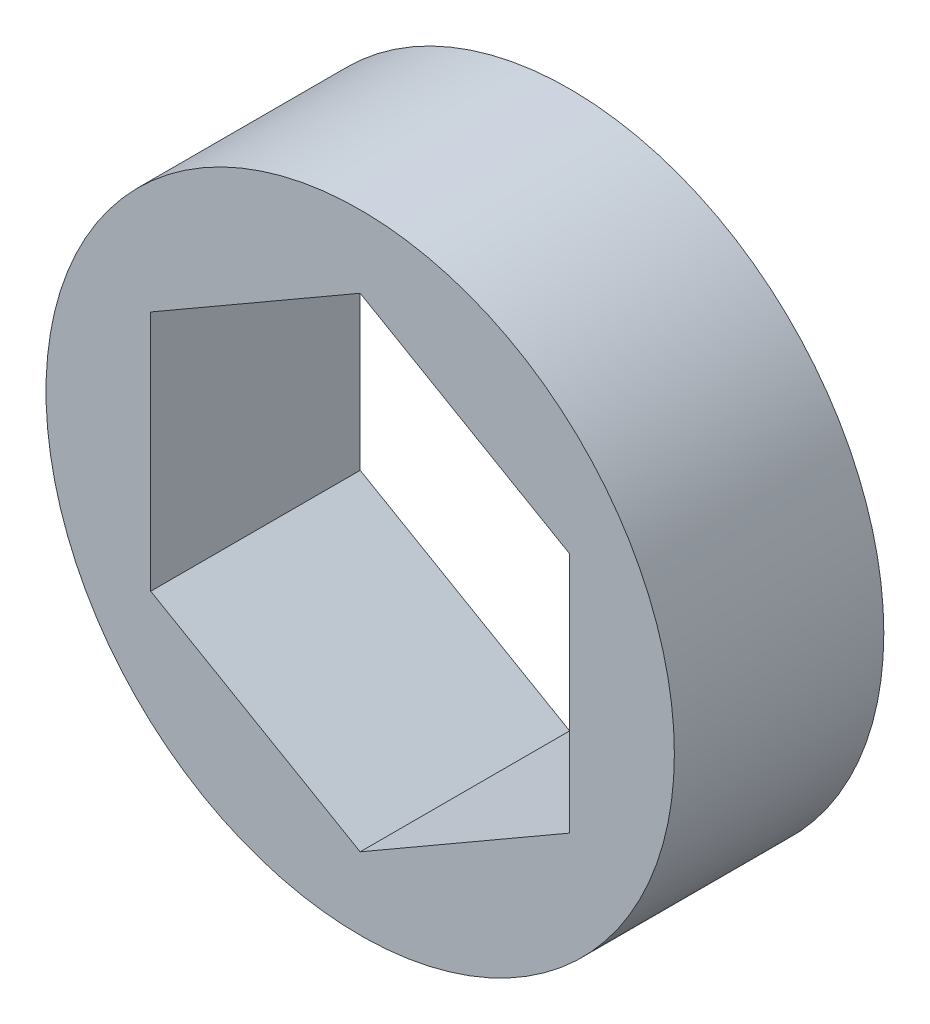
from build123d import *

# Parameters (mm, degrees)
SKETCH1_R           = 9.525
BOSS_EXTRUDE1_DEPTH = 3.175


with BuildPart() as part:
    # Sketch1 → Boss-Extrude1 (new, symmetric)
    with BuildSketch(Plane.XY):
        Circle(SKETCH1_R)
        Polygon((0, 7.332348419), (-6.35, 3.666174209), (-6.35, -3.666174209), (0, -7.332348419), (6.35, -3.666174209), (6.35, 3.666174209), align=None, mode=Mode.SUBTRACT)
    extrude(amount=BOSS_EXTRUDE1_DEPTH, both=True)


solid = part.part
